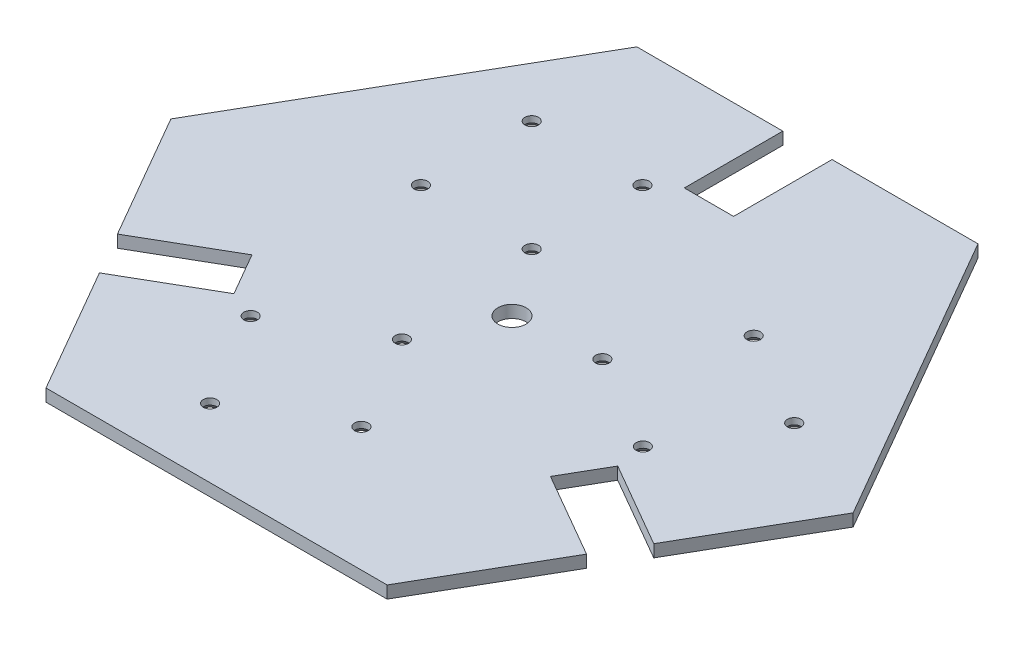
from build123d import *

# Parameters (mm, degrees)
BOSS_EXTRUDE1_DEPTH                            = 5
SKETCH5_R                                      = 5.753179175
CUT_EXTRUDE1_DEPTH                             = 184.371208209
CSK_FOR_M5_FLAT_HEAD_MACHINE_SCREW1_AT_2_COUNT = 2
CSK_FOR_M5_FLAT_HEAD_MACHINE_SCREW1_AT_2_PITCH = 45
CSK_FOR_M5_FLAT_HEAD_MACHINE_SCREW1_AT_3_COUNT = 2
CSK_FOR_M5_FLAT_HEAD_MACHINE_SCREW1_AT_3_PITCH = 63.639610307
CSK_FOR_M5_FLAT_HEAD_MACHINE_SCREW1_AT_4_COUNT = 2
CSK_FOR_M5_FLAT_HEAD_MACHINE_SCREW1_AT_4_PITCH = 45
CSK_FOR_M5_FLAT_HEAD_MACHINE_SCREW1_AT_5_COUNT = 2
CSK_FOR_M5_FLAT_HEAD_MACHINE_SCREW1_AT_5_PITCH = 101.046587643
CSK_FOR_M5_FLAT_HEAD_MACHINE_SCREW1_AT_6_COUNT = 2
CSK_FOR_M5_FLAT_HEAD_MACHINE_SCREW1_AT_6_PITCH = 144.828140716
CSK_FOR_M5_FLAT_HEAD_MACHINE_SCREW1_AT_7_COUNT = 2
CSK_FOR_M5_FLAT_HEAD_MACHINE_SCREW1_AT_7_PITCH = 159.73189246
CSK_FOR_M5_FLAT_HEAD_MACHINE_SCREW1_AT_8_COUNT = 2
CSK_FOR_M5_FLAT_HEAD_MACHINE_SCREW1_AT_8_PITCH = 121.44751953
CSK_FOR_M5_FLAT_HEAD_MACHINE_SCREW1_AT_9_COUNT = 2
CSK_FOR_M5_FLAT_HEAD_MACHINE_SCREW1_AT_9_PITCH = 76.964843439
CSK_FOR_M5_FLAT_HEAD_MACHINE_SCREW1_AT_1_COUNT = 2
CSK_FOR_M5_FLAT_HEAD_MACHINE_SCREW1_AT_1_PITCH = 121.44751953
CSK_FOR_M5_FLAT_HEAD_MACHINE_SCREW1_2_COUNT    = 2
CSK_FOR_M5_FLAT_HEAD_MACHINE_SCREW1_2_PITCH    = 124.337132551
CSK_FOR_M5_FLAT_HEAD_MACHINE_SCREW1_3_COUNT    = 2
CSK_FOR_M5_FLAT_HEAD_MACHINE_SCREW1_3_PITCH    = 81.448202292
SKETCH8_W                                      = 20
SKETCH8_H                                      = 40
CUT_EXTRUDE2_DEPTH                             = 184.371208209


with BuildPart() as part:
    # Sketch1 → Boss-Extrude1 (new body)
    with BuildSketch(Plane(origin=(0, 0, 0), x_dir=(1, 0, 0), z_dir=(0, 1, 0))):
        Polygon((69.282032303, 120), (-69.282032303, 120), (-138.564064606, 0), (-69.282032303, -120), (69.282032303, -120), (138.564064606, 0), align=None)
    extrude(amount=BOSS_EXTRUDE1_DEPTH)

    # Sketch5 → Cut-Extrude1 (cut, through all)
    with BuildSketch(Plane(origin=(0, 5, 0), x_dir=(1, 0, 0), z_dir=(0, 1, 0))):
        Circle(SKETCH5_R)
    extrude(amount=-CUT_EXTRUDE1_DEPTH, mode=Mode.SUBTRACT)

    # Sketch6 → CSK for M5 Flat Head Machine Screw1 (revolve, cut)
    with BuildSketch(Plane(origin=(-64.5, 0, -27.5), x_dir=(0, 0, -1), z_dir=(1, 0, 0))):
        Polygon((0, 0), (0, 5), (2.75, 5), (2.75, 2.45), (5.2, 0), align=None)
    csk_for_m5_flat_head_machine_screw1 = revolve(axis=Axis((-64.5, -6.35, -27.5), (0, 1, 0)), mode=Mode.SUBTRACT)

    # CSK for M5 Flat Head Machine Screw1 at 2: CSK for M5 Flat Head Machine Screw1 ×2
    with Locations(*[(i * CSK_FOR_M5_FLAT_HEAD_MACHINE_SCREW1_AT_2_PITCH, 0, 0) for i in range(1, CSK_FOR_M5_FLAT_HEAD_MACHINE_SCREW1_AT_2_COUNT)]):
        add(csk_for_m5_flat_head_machine_screw1, mode=Mode.SUBTRACT)

    # CSK for M5 Flat Head Machine Screw1 at 3: CSK for M5 Flat Head Machine Screw1 ×2
    with Locations(*[Vector(0.7071067811865467, 0, -0.7071067811865485) * (i * CSK_FOR_M5_FLAT_HEAD_MACHINE_SCREW1_AT_3_PITCH) for i in range(1, CSK_FOR_M5_FLAT_HEAD_MACHINE_SCREW1_AT_3_COUNT)]):
        add(csk_for_m5_flat_head_machine_screw1, mode=Mode.SUBTRACT)

    # CSK for M5 Flat Head Machine Screw1 at 4: CSK for M5 Flat Head Machine Screw1 ×2
    with Locations(*[(0, 0, -i * CSK_FOR_M5_FLAT_HEAD_MACHINE_SCREW1_AT_4_PITCH) for i in range(1, CSK_FOR_M5_FLAT_HEAD_MACHINE_SCREW1_AT_4_COUNT)]):
        add(csk_for_m5_flat_head_machine_screw1, mode=Mode.SUBTRACT)

    # CSK for M5 Flat Head Machine Screw1 at 5: CSK for M5 Flat Head Machine Screw1 ×2
    with Locations(*[Vector(0.9704998544848913, 0, 0.2411017056032681) * (i * CSK_FOR_M5_FLAT_HEAD_MACHINE_SCREW1_AT_5_PITCH) for i in range(1, CSK_FOR_M5_FLAT_HEAD_MACHINE_SCREW1_AT_5_COUNT)]):
        add(csk_for_m5_flat_head_machine_screw1, mode=Mode.SUBTRACT)

    # CSK for M5 Flat Head Machine Screw1 at 6: CSK for M5 Flat Head Machine Screw1 ×2
    with Locations(*[Vector(0.9462031418522925, 0, 0.32357319782214755) * (i * CSK_FOR_M5_FLAT_HEAD_MACHINE_SCREW1_AT_6_PITCH) for i in range(1, CSK_FOR_M5_FLAT_HEAD_MACHINE_SCREW1_AT_6_COUNT)]):
        add(csk_for_m5_flat_head_machine_screw1, mode=Mode.SUBTRACT)

    # CSK for M5 Flat Head Machine Screw1 at 7: CSK for M5 Flat Head Machine Screw1 ×2
    with Locations(*[Vector(0.9987788870275944, 0, 0.04940379365918945) * (i * CSK_FOR_M5_FLAT_HEAD_MACHINE_SCREW1_AT_7_PITCH) for i in range(1, CSK_FOR_M5_FLAT_HEAD_MACHINE_SCREW1_AT_7_COUNT)]):
        add(csk_for_m5_flat_head_machine_screw1, mode=Mode.SUBTRACT)

    # CSK for M5 Flat Head Machine Screw1 at 8: CSK for M5 Flat Head Machine Screw1 ×2
    with Locations(*[Vector(0.9927390783329083, 0, -0.12028766499823594) * (i * CSK_FOR_M5_FLAT_HEAD_MACHINE_SCREW1_AT_8_PITCH) for i in range(1, CSK_FOR_M5_FLAT_HEAD_MACHINE_SCREW1_AT_8_COUNT)]):
        add(csk_for_m5_flat_head_machine_screw1, mode=Mode.SUBTRACT)

    # CSK for M5 Flat Head Machine Screw1 at 9: CSK for M5 Flat Head Machine Screw1 ×2
    with Locations(*[Vector(0.6552901187373239, 0, 0.7553772966440175) * (i * CSK_FOR_M5_FLAT_HEAD_MACHINE_SCREW1_AT_9_PITCH) for i in range(1, CSK_FOR_M5_FLAT_HEAD_MACHINE_SCREW1_AT_9_COUNT)]):
        add(csk_for_m5_flat_head_machine_screw1, mode=Mode.SUBTRACT)

    # CSK for M5 Flat Head Machine Screw1 at 1: CSK for M5 Flat Head Machine Screw1 ×2
    with Locations(*[Vector(0.6005417128168388, 0, 0.7995934286667303) * (i * CSK_FOR_M5_FLAT_HEAD_MACHINE_SCREW1_AT_1_PITCH) for i in range(1, CSK_FOR_M5_FLAT_HEAD_MACHINE_SCREW1_AT_1_COUNT)]):
        add(csk_for_m5_flat_head_machine_screw1, mode=Mode.SUBTRACT)

    # CSK for M5 Flat Head Machine Screw1  2: CSK for M5 Flat Head Machine Screw1 ×2
    with Locations(*[Vector(0.2731537838197167, 0, 0.9619703791619426) * (i * CSK_FOR_M5_FLAT_HEAD_MACHINE_SCREW1_2_PITCH) for i in range(1, CSK_FOR_M5_FLAT_HEAD_MACHINE_SCREW1_2_COUNT)]):
        add(csk_for_m5_flat_head_machine_screw1, mode=Mode.SUBTRACT)

    # CSK for M5 Flat Head Machine Screw1  3: CSK for M5 Flat Head Machine Screw1 ×2
    with Locations(*[Vector(0.14074169721357913, 0, 0.9900463497561319) * (i * CSK_FOR_M5_FLAT_HEAD_MACHINE_SCREW1_3_PITCH) for i in range(1, CSK_FOR_M5_FLAT_HEAD_MACHINE_SCREW1_3_COUNT)]):
        add(csk_for_m5_flat_head_machine_screw1, mode=Mode.SUBTRACT)

    # Sketch8 → Cut-Extrude2 (cut, through all)
    with BuildSketch(Plane.XZ):
        Polygon((98.923048454, 68.660254038), (108.923048454, 51.339745962), (74.282032303, 31.339745962), (64.282032303, 48.660254038), align=None)
        with Locations((0, -100)):
            Rectangle(SKETCH8_W, SKETCH8_H)
        Polygon((-108.923048454, 51.339745962), (-98.923048454, 68.660254038), (-64.282032303, 48.660254038), (-74.282032303, 31.339745962), align=None)
    extrude(amount=-CUT_EXTRUDE2_DEPTH, mode=Mode.SUBTRACT)


solid = part.part
